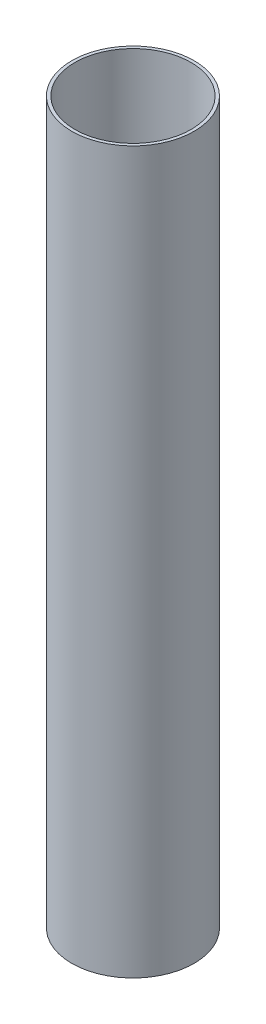
from build123d import *

# Parameters (mm, degrees)
SKETCH1_R                          = 33.9725
SKETCH1_R_2                        = 32.258
BOSS_EXTRUDE1_DEPTH                = 400
SKETCH2_W                          = 33.9725
SKETCH2_H                          = 40
UMBILICAL_CONNECTOR_PASSTHRU_ANGLE = 20


with BuildPart() as part:
    # Sketch1 → Boss-Extrude1 (new body)
    with BuildSketch(Plane(origin=(0, 0, 0), x_dir=(1, 0, 0), z_dir=(0, 1, 0))):
        Circle(SKETCH1_R)
        Circle(SKETCH1_R_2, mode=Mode.SUBTRACT)
    extrude(amount=BOSS_EXTRUDE1_DEPTH)

    # Sketch2 → UMBILICAL CONNECTOR PASSTHRU (revolve, symmetric, cut)
    with BuildSketch(Plane(origin=(0, 0, 0), x_dir=(0.7071067811865477, 0, 0.7071067811865475), z_dir=(-0.7071067811865475, 0, 0.7071067811865477))) as umbilical_connector_passthru_sk:
        with Locations((-16.98625, 159)):
            Rectangle(SKETCH2_W, SKETCH2_H)
    revolve(axis=Axis((0, 179, 0), (0, -1, 0)), revolution_arc=UMBILICAL_CONNECTOR_PASSTHRU_ANGLE / 2, mode=Mode.SUBTRACT)
    revolve(umbilical_connector_passthru_sk.sketch, axis=Axis((0, 179, 0), (0, 1, 0)), revolution_arc=UMBILICAL_CONNECTOR_PASSTHRU_ANGLE / 2, mode=Mode.SUBTRACT)


solid = part.part
